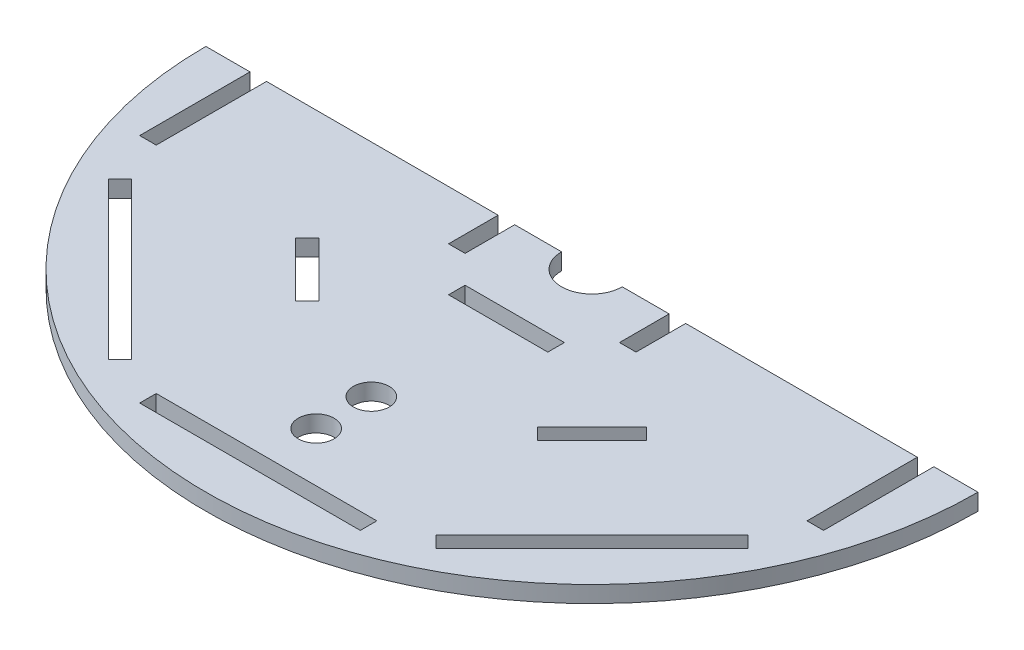
from build123d import *

# Parameters (mm, degrees)
CROQUIS1_R              = 3.25
SALIENTE_EXTRUIR1_DEPTH = 3


with BuildPart() as part:
    # Croquis1 → Saliente-Extruir1 (new body)
    with BuildSketch(Plane(origin=(0, 0, 0), x_dir=(1, 0, 0), z_dir=(0, 1, 0))):
        with BuildLine():
            Line((-59, 0), (-17, 0))
            Line((-17, 0), (-17, -9))
            Line((-17, -9), (-14, -9))
            Line((-14, -9), (-14, 0))
            Line((-14, 0), (-5.5, 0))
            ThreePointArc((-5.5, 0), (0, -5.5), (5.5, 0))
            Line((5.5, 0), (14, 0))
            Line((14, 0), (14, -9))
            Line((14, -9), (17, -9))
            Line((17, -9), (17, 0))
            Line((17, 0), (59, 0))
            Line((59, 0), (59, -20))
            Line((59, -20), (62, -20))
            Line((62, -20), (62, 0))
            Line((62, 0), (70, 0))
            ThreePointArc((70, 0), (0, -70), (-70, 0))
            Line((-70, 0), (-62, 0))
            Line((-62, 0), (-62, -20))
            Line((-62, -20), (-59, -20))
            Line((-59, -20), (-59, 0))
        make_face()
        with Locations((0, -50)):
            Circle(CROQUIS1_R, mode=Mode.SUBTRACT)
        with Locations((0, -40)):
            Circle(CROQUIS1_R, mode=Mode.SUBTRACT)
        Polygon((24.748737342, -24.748737342), (19.798989873, -29.69848481), (21.920310217, -31.819805153), (31.819805153, -21.920310217), (29.69848481, -19.798989873), align=None, mode=Mode.SUBTRACT)
        Polygon((-24.748737342, -24.748737342), (-29.69848481, -19.798989873), (-31.819805153, -21.920310217), (-21.920310217, -31.819805153), (-19.798989873, -29.69848481), align=None, mode=Mode.SUBTRACT)
        Polygon((-9, -14), (-9, -17), (9, -17), (9, -14), (0, -14), align=None, mode=Mode.SUBTRACT)
        Polygon((27.577164466, -55.861435714), (55.861435714, -27.577164466), (57.982756057, -29.69848481), (43.840620434, -43.840620434), (29.69848481, -57.982756057), align=None, mode=Mode.SUBTRACT)
        Polygon((-20, -59), (20, -59), (20, -62), (0, -62), (-20, -62), align=None, mode=Mode.SUBTRACT)
        Polygon((-55.861435714, -27.577164466), (-27.577164466, -55.861435714), (-29.69848481, -57.982756057), (-43.840620434, -43.840620434), (-57.982756057, -29.69848481), align=None, mode=Mode.SUBTRACT)
    extrude(amount=SALIENTE_EXTRUIR1_DEPTH)


solid = part.part
